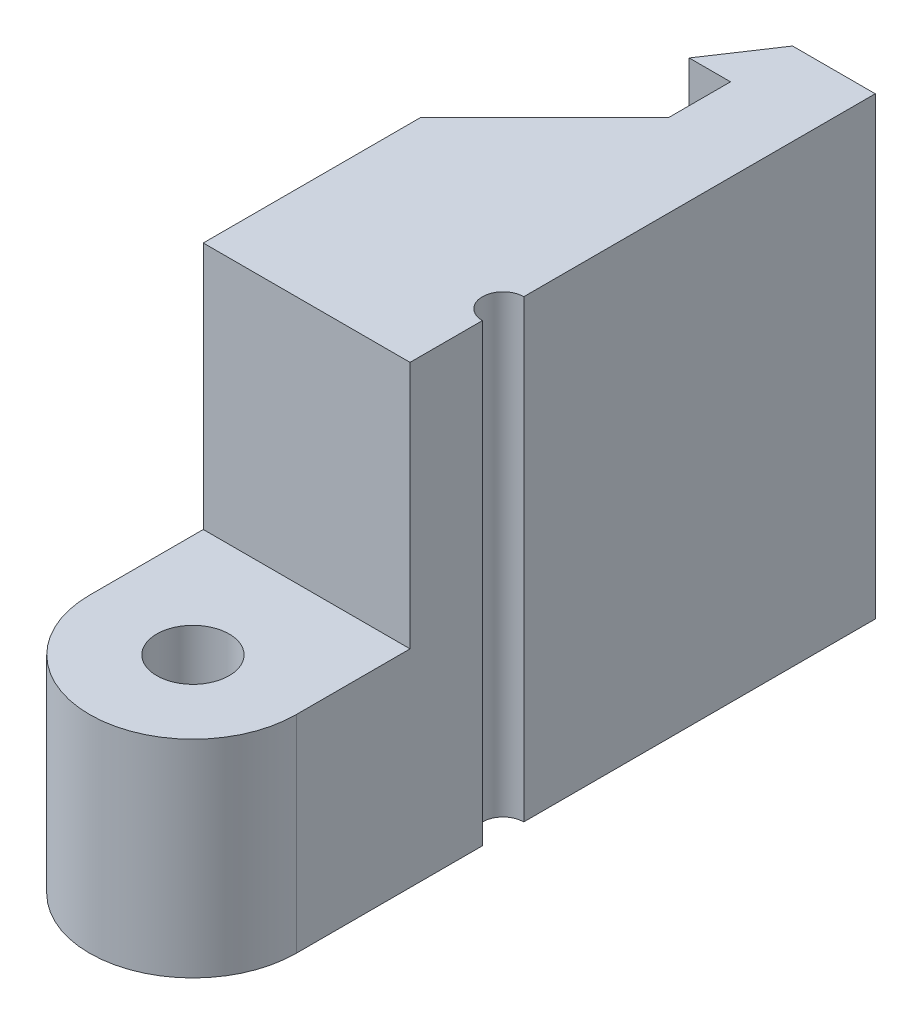
from build123d import *

# Parameters (mm, degrees)
SKETCH1_R           = 1.75
BOSS_EXTRUDE1_DEPTH = 10
BOSS_EXTRUDE2_DEPTH = 12
BOSS_EXTRUDE3_DEPTH = 22
CHAMFER1_SIZE       = 6


with BuildPart() as part:
    # Sketch1 → Boss-Extrude1 (new body)
    with BuildSketch(Plane(origin=(0, 0, 0), x_dir=(1, 0, 0), z_dir=(0, 1, 0))):
        with BuildLine():
            Line((-5, 22), (-5, 0))
            ThreePointArc((-5, 0), (0, -5), (5, 0))
            Line((5, 0), (5, 9))
            ThreePointArc((5, 9), (4, 10), (5, 11))
            Line((5, 11), (5, 22))
            Line((5, 22), (-5, 22))
        make_face()
        with Locations(Location((0, 0, 0), (0, 0, 270))):
            Circle(SKETCH1_R, mode=Mode.SUBTRACT)
    extrude(amount=BOSS_EXTRUDE1_DEPTH)

    # Sketch3 → Boss-Extrude2 (add)
    with BuildSketch(Plane(origin=(0, 10, 0), x_dir=(1, 0, 0), z_dir=(0, 1, 0))):
        with BuildLine():
            Line((5, 5.5), (-5, 5.5))
            Line((-5, 5.5), (-5, 22))
            Line((-5, 22), (5, 22))
            Line((5, 22), (5, 11))
            ThreePointArc((5, 11), (4, 10), (5, 9))
            Line((5, 9), (5, 5.5))
        make_face()
    extrude(amount=BOSS_EXTRUDE2_DEPTH)

    # Sketch5 → Boss-Extrude3 (add)
    with BuildSketch(Plane(origin=(0, 22, 0), x_dir=(1, 0, 0), z_dir=(0, 1, 0))):
        Polygon((5, 22), (5, 28), (1, 28), (-1, 25), (1, 25), (1, 22), align=None)
    extrude(amount=-BOSS_EXTRUDE3_DEPTH)

    # Chamfer1
    chamfer1_edges = [part.edges().sort_by_distance(p)[0] for p in [
        (-5, 11, -22),
    ]]
    chamfer(chamfer1_edges, length=CHAMFER1_SIZE - 0.0001)  # a hair under: the kernel refuses the full size


solid = part.part
